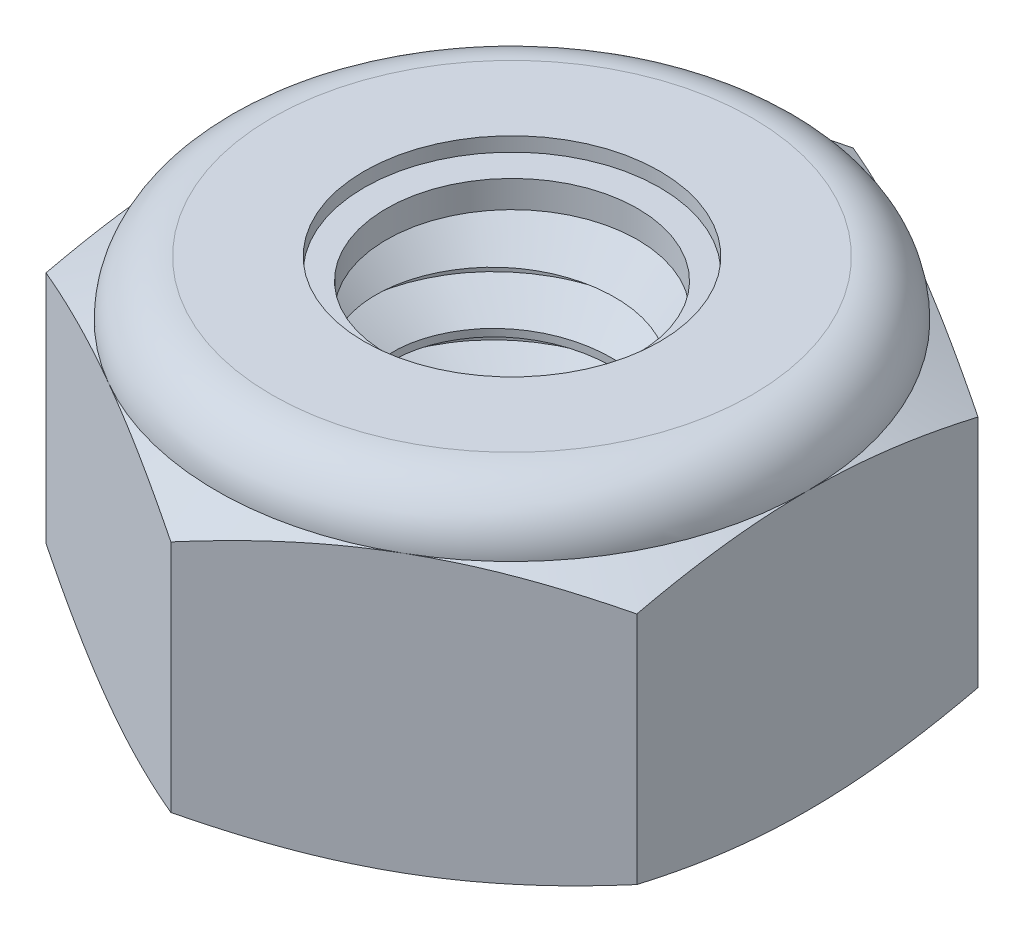
from build123d import *

# Parameters (mm, degrees)
EXTRUDE1_DEPTH               = 1.785938
EXTRUDE1_DEPTH_BACK          = 1.785938
SKETCH13_R                   = 1.5875
SWEEP4_PITCH                 = 0.635
SKETCH18_R                   = 1.656240766
CUT_EXTRUDE1_OTHER_WAY_DEPTH = 7.433242666
SKETCH19_R                   = 1.656240766
CUT_EXTRUDE2_OTHER_WAY_DEPTH = 6.669805492


with BuildPart() as part:
    # Sketch13 → Extrude1 (new, two sides: drawn at the far end of the back side and taken through both)
    with BuildSketch(Plane(origin=(0, 0, 0), x_dir=(1, 0, 0), z_dir=(0, 1, 0)).offset(-EXTRUDE1_DEPTH_BACK)):
        Polygon((0, 3.666174209), (-3.175, 1.833087105), (-3.175, -1.833087105), (0, -3.666174209), (3.175, -1.833087105), (3.175, 1.833087105), align=None)
        with Locations(Location((0, 0, 0), (0, 0, 90))):
            Circle(SKETCH13_R, mode=Mode.SUBTRACT)
    extrude(amount=EXTRUDE1_DEPTH + EXTRUDE1_DEPTH_BACK)

    # Sketch5 → Cut-Revolve3 (revolve, cut)
    with BuildSketch(Plane(origin=(0, 0, 0), x_dir=(0, 0, -1), z_dir=(1, 0, 0))):
        with BuildLine():
            Line((0, -1.7859375), (3.175, -1.7859375))
            Line((3.175, -1.7859375), (3.666174209, -1.556899205))
            Line((3.666174209, -1.556899205), (3.666174209, 0.961586705))
            Line((3.666174209, 0.961586705), (3.175, 1.190625))
            ThreePointArc((3.175, 1.190625), (3.000637006, 1.611574506), (2.5796875, 1.7859375))
            Line((2.5796875, 1.7859375), (2.5796875, 3.0559375))
            Line((2.5796875, 3.0559375), (4.936174209, 3.0559375))
            Line((4.936174209, 3.0559375), (4.936174209, -3.0559375))
            Line((4.936174209, -3.0559375), (0, -3.0559375))
            Line((0, -3.0559375), (0, -1.7859375))
        make_face()
    revolve(axis=Axis((0, -1.7859375, 0), (0, 1, 0)), mode=Mode.SUBTRACT)

    # Sketch6 → Cut-Revolve4 (revolve, cut)
    with BuildSketch(Plane(origin=(0, 0, 0), x_dir=(0, 0, -1), z_dir=(1, 0, 0))):
        with BuildLine():
            Line((0, 1.190625), (3.0226, 1.190625))
            ThreePointArc((3.0226, 1.190625), (2.892873932, 1.503811432), (2.5796875, 1.6335375))
            Line((2.5796875, 1.6335375), (1.28984375, 1.6335375))
            Line((1.28984375, 1.6335375), (1.28984375, 3.0559375))
            Line((1.28984375, 3.0559375), (0, 3.0559375))
            Line((0, 3.0559375), (0, 1.190625))
        make_face()
    revolve(axis=Axis((0, 3.0559375, 0), (0, -1, 0)), mode=Mode.SUBTRACT)


with BuildPart() as body_2:
    # Sketch7 → Revolve2 (revolve)
    with BuildSketch(Plane(origin=(0, 0, 0), x_dir=(0, 0, -1), z_dir=(1, 0, 0))):
        with BuildLine():
            Line((1.349375, 1.266825), (2.938395763, 1.266825))
            ThreePointArc((2.938395763, 1.266825), (2.810484559, 1.475600043), (2.5796875, 1.5573375))
            Line((2.5796875, 1.5573375), (1.349375, 1.5573375))
            Line((1.349375, 1.5573375), (1.349375, 1.266825))
        make_face()
    revolve(axis=Axis((0, 1.266825, 0), (0, 1, 0)))


with BuildPart() as body_3:
    # Split1: the piece on the far side of the plane
    add(part.part)
    split(bisect_by=Plane.ZX.offset(1.1509375), keep=Keep.BOTTOM)

    # Sweep4: the profile of Sketch14 screwed along a right-hand helix of 6.625 turns, 6 arcs to a turn; built about Z, then put on its axis
    sweep4_z = Axis((0, 0, 0), (0, 0, 1))
    sweep4_corners = [(1.175055401, 0, -0.3175), (1.621870383, 0, -0.57546875), (1.621870383, 0, 0.01984375), (1.175055401, 0, -0.238125)]
    with BuildLine(mode=Mode.PRIVATE) as sweep4_profile:
        Line(sweep4_corners[0], sweep4_corners[1])
        Line(sweep4_corners[1], sweep4_corners[2])
        Line(sweep4_corners[2], sweep4_corners[3])
        Line(sweep4_corners[3], sweep4_corners[0])
    sweep4_cap = Face(sweep4_profile.wire())
    sweep4_turn_angles = [0, 30, 60, 90, 120, 150, 180, 210, 240, 270, 300, 330, 360]
    sweep4_turn_weights = [1, 0.8660254037844387, 1, 0.8660254037844387, 1, 0.8660254037844387, 1, 0.8660254037844387, 1, 0.8660254037844387, 1, 0.8660254037844387, 1]
    sweep4_turn_rails = [Edge.make_bspline([Vector(p[0], p[1], 0).rotate(sweep4_z, sweep4_turn_angles[k]) / sweep4_turn_weights[k] + Vector(0, 0, p[2] + SWEEP4_PITCH * sweep4_turn_angles[k] / 360) for k in range(13)], [0, 0, 0, 1, 1, 2, 2, 3, 3, 4, 4, 5, 5, 6, 6, 6], 2, sweep4_turn_weights) for p in sweep4_corners]
    sweep4_turn_sides = [Face.make_surface_from_curves(sweep4_turn_rails[p[0]], sweep4_turn_rails[p[1]]) for p in [(0, 1), (1, 2), (2, 3), (3, 0)]]
    sweep4_last_angles = [2160, 2190, 2220, 2250, 2280, 2310, 2340, 2362.5, 2385]
    sweep4_last_weights = [1, 0.8660254037844387, 1, 0.8660254037844387, 1, 0.8660254037844387, 1, 0.9238795325112701, 1]
    sweep4_last_rails = [Edge.make_bspline([Vector(p[0], p[1], 0).rotate(sweep4_z, sweep4_last_angles[k]) / sweep4_last_weights[k] + Vector(0, 0, p[2] + SWEEP4_PITCH * sweep4_last_angles[k] / 360) for k in range(9)], [0, 0, 0, 1, 1, 2, 2, 3, 3, 4, 4, 4], 2, sweep4_last_weights) for p in sweep4_corners]
    sweep4_last_sides = [Face.make_surface_from_curves(sweep4_last_rails[p[0]], sweep4_last_rails[p[1]]) for p in [(0, 1), (1, 2), (2, 3), (3, 0)]]
    sweep4 = Plane(origin=(0, -1.7859375, 0), x_dir=(0, 0, 1), z_dir=(0, 1, 0)) * Solid(Shell([*[p.moved(Location((0, 0, SWEEP4_PITCH * i))) for i in range(6) for p in sweep4_turn_sides], *sweep4_last_sides, sweep4_cap, sweep4_cap.rotate(sweep4_z, 2385).moved(Location((0, 0, SWEEP4_PITCH * 2385 / 360)))]))
    add(sweep4)

    # Cut-Extrude1 cone 1 section (through the dimple's axis) → Cut-Extrude1 (revolve, cut)
    with BuildSketch(Plane(origin=(0, -1.7859375, 0), x_dir=(0, 0, -1), z_dir=(1, 0, 0))):
        Polygon((0, 0), (1.656240766, 0), (0, 1.656240766), align=None)
    revolve(axis=Axis((0, -1.7859375, 0), (0, 1, 0)), mode=Mode.SUBTRACT)

    # Sketch18 → Cut-Extrude1 other way (cut)
    with BuildSketch(Plane.XZ.offset(1.7859375)):
        Circle(SKETCH18_R)
    extrude(amount=CUT_EXTRUDE1_OTHER_WAY_DEPTH, mode=Mode.SUBTRACT)

    # Cut-Extrude2 cone 1 section (through the dimple's axis) → Cut-Extrude2 (revolve, cut)
    with BuildSketch(Plane(origin=(0, 1.1509375, 0), x_dir=(0, 0, 1), z_dir=(1, 0, 0))):
        Polygon((0, 0), (1.656240766, 0), (0, 1.656240766), align=None)
    revolve(axis=Axis((0, 1.1509375, 0), (0, -1, 0)), mode=Mode.SUBTRACT)

    # Sketch19 → Cut-Extrude2 other way (cut)
    with BuildSketch(Plane(origin=(0, 1.1509375, 0), x_dir=(1, 0, 0), z_dir=(0, 1, 0))):
        Circle(SKETCH19_R)
    extrude(amount=CUT_EXTRUDE2_OTHER_WAY_DEPTH, mode=Mode.SUBTRACT)


with BuildPart() as part_1:
    add(part.part)

    # Split1
    split(bisect_by=Plane.ZX.offset(1.1509375), keep=Keep.TOP)

    # Combine1: union body 3
    add(body_3.part)


solid = Compound([body_2.part, part_1.part])
